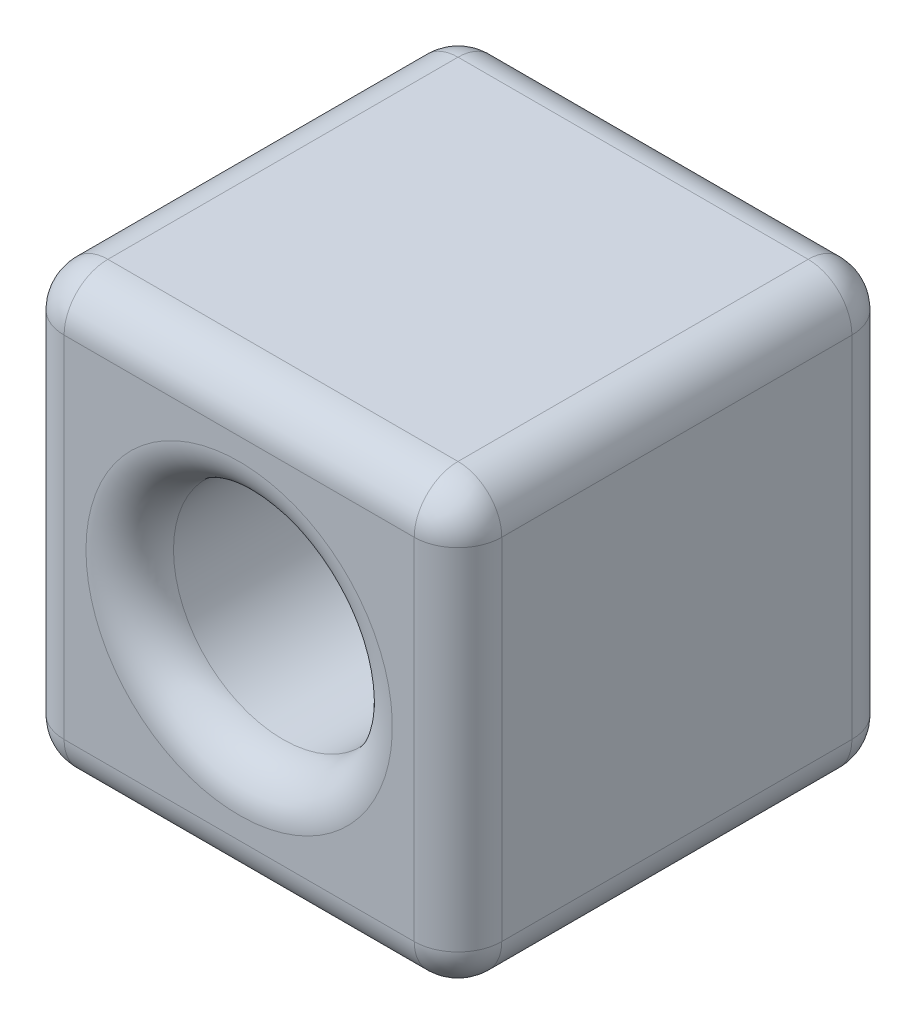
from build123d import *

# Parameters (mm, degrees)
SKETCH2_W           = 100
SKETCH2_H           = 100
BOSS_EXTRUDE1_DEPTH = 100
SKETCH3_R           = 25
CUT_EXTRUDE1_DEPTH  = 100
FILLET1_R           = 10
FILLET2_R           = 10
FILLET3_R           = 10
FILLET4_R           = 10


with BuildPart() as part:
    # Sketch2 → Boss-Extrude1 (new body)
    with BuildSketch(Plane(origin=(0, 0, 0), x_dir=(1, 0, 0), z_dir=(0, 1, 0))):
        with Locations((50, 50)):
            Rectangle(SKETCH2_W, SKETCH2_H)
    extrude(amount=BOSS_EXTRUDE1_DEPTH)

    # Sketch3 → Cut-Extrude1 (cut)
    with BuildSketch(Plane.XY):
        with Locations((50, 50)):
            Circle(SKETCH3_R)
    extrude(amount=-CUT_EXTRUDE1_DEPTH, mode=Mode.SUBTRACT)

    # Fillet1
    fillet1_edges = [part.edges().sort_by_distance(p)[0] for p in [
        (25, 50, 0),
        (50, 0, 0),
        (100, 50, 0),
        (0, 50, 0),
        (50, 100, 0),
    ]]
    fillet(fillet1_edges, radius=FILLET1_R)

    # Fillet2
    fillet2_edges = [part.edges().sort_by_distance(p)[0] for p in [
        (25, 50, -100),
        (50, 100, -100),
        (50, 0, -100),
        (0, 50, -100),
        (100, 50, -100),
    ]]
    fillet(fillet2_edges, radius=FILLET2_R)

    # Fillet3
    # the kernel refuses this fillet: 10 mm, written as the material it takes off along each edge
    with BuildSketch(Plane(origin=(90, 90, -10), x_dir=(1, 0, 0), z_dir=(0, 1, 0))) as fillet3_piece_1_section:
        Polygon((0, 0), (FILLET3_R, 0), (FILLET3_R, -FILLET3_R), (0, -FILLET3_R), align=None)
    fillet3_piece_1 = extrude(amount=FILLET3_R, mode=Mode.PRIVATE)
    fillet3_piece_1 = fillet3_piece_1 - Plane(origin=(90, 90, -10), x_dir=(-0.7071067811865475, 0, -0.7071067811865475), z_dir=(0, 1, 0)) * Sphere(FILLET3_R, mode=Mode.PRIVATE)
    add(fillet3_piece_1, mode=Mode.SUBTRACT)
    with BuildSketch(Plane(origin=(90, 10, -10), x_dir=(0, -1, 0), z_dir=(1, 0, 0))) as fillet3_piece_2_section:
        Polygon((0, 0), (FILLET3_R, 0), (FILLET3_R, -FILLET3_R), (0, -FILLET3_R), align=None)
    fillet3_piece_2 = extrude(amount=FILLET3_R, mode=Mode.PRIVATE)
    fillet3_piece_2 = fillet3_piece_2 - Plane(origin=(90, 10, -10), x_dir=(0, 0.7071067811865475, -0.7071067811865475), z_dir=(1, 0, 0)) * Sphere(FILLET3_R, mode=Mode.PRIVATE)
    add(fillet3_piece_2, mode=Mode.SUBTRACT)
    with BuildSketch(Plane(origin=(90, 90, -90), x_dir=(1, 0, 0), z_dir=(0, 1, 0))) as fillet3_piece_3_section:
        Polygon((0, 0), (FILLET3_R, 0), (FILLET3_R, FILLET3_R), (0, FILLET3_R), align=None)
    fillet3_piece_3 = extrude(amount=FILLET3_R, mode=Mode.PRIVATE)
    fillet3_piece_3 = fillet3_piece_3 - Plane(origin=(90, 90, -90), x_dir=(-0.7071067811865475, 0, 0.7071067811865475), z_dir=(0, 1, 0)) * Sphere(FILLET3_R, mode=Mode.PRIVATE)
    add(fillet3_piece_3, mode=Mode.SUBTRACT)
    with BuildSketch(Plane(origin=(90, 10, -90), x_dir=(0, -1, 0), z_dir=(1, 0, 0))) as fillet3_piece_4_section:
        Polygon((0, 0), (FILLET3_R, 0), (FILLET3_R, FILLET3_R), (0, FILLET3_R), align=None)
    fillet3_piece_4 = extrude(amount=FILLET3_R, mode=Mode.PRIVATE)
    fillet3_piece_4 = fillet3_piece_4 - Plane(origin=(90, 10, -90), x_dir=(0, 0.7071067811865475, 0.7071067811865475), z_dir=(1, 0, 0)) * Sphere(FILLET3_R, mode=Mode.PRIVATE)
    add(fillet3_piece_4, mode=Mode.SUBTRACT)
    with BuildSketch(Plane(origin=(100, 100, -10), x_dir=(-1, 0, 0), z_dir=(0, 0, -1)), Plane(origin=(100, 0, -10), x_dir=(0, 1, 0), z_dir=(0, 0, -1))) as fillet3_piece_5:
        with BuildLine():
            CenterArc((FILLET3_R, -FILLET3_R), FILLET3_R, 90, 90)
            Line((0, -FILLET3_R), (0, 0))
            Line((0, 0), (FILLET3_R, 0))
        make_face()
    extrude(amount=80, mode=Mode.SUBTRACT)

    # Fillet4
    # the kernel refuses this fillet: 10 mm, written as the material it takes off along each edge
    with BuildSketch(Plane(origin=(10, 90, -10), x_dir=(-1, 0, 0), z_dir=(0, 1, 0))) as fillet4_piece_1_section:
        Polygon((0, 0), (FILLET4_R, 0), (FILLET4_R, FILLET4_R), (0, FILLET4_R), align=None)
    fillet4_piece_1 = extrude(amount=FILLET4_R, mode=Mode.PRIVATE)
    fillet4_piece_1 = fillet4_piece_1 - Plane(origin=(10, 90, -10), x_dir=(0.7071067811865475, 0, -0.7071067811865475), z_dir=(0, 1, 0)) * Sphere(FILLET4_R, mode=Mode.PRIVATE)
    add(fillet4_piece_1, mode=Mode.SUBTRACT)
    with BuildSketch(Plane(origin=(10, 10, -10), x_dir=(0, -1, 0), z_dir=(-1, 0, 0))) as fillet4_piece_2_section:
        Polygon((0, 0), (FILLET4_R, 0), (FILLET4_R, FILLET4_R), (0, FILLET4_R), align=None)
    fillet4_piece_2 = extrude(amount=FILLET4_R, mode=Mode.PRIVATE)
    fillet4_piece_2 = fillet4_piece_2 - Plane(origin=(10, 10, -10), x_dir=(0, 0.7071067811865475, -0.7071067811865475), z_dir=(-1, 0, 0)) * Sphere(FILLET4_R, mode=Mode.PRIVATE)
    add(fillet4_piece_2, mode=Mode.SUBTRACT)
    with BuildSketch(Plane(origin=(10, 90, -90), x_dir=(-1, 0, 0), z_dir=(0, 1, 0))) as fillet4_piece_3_section:
        Polygon((0, 0), (FILLET4_R, 0), (FILLET4_R, -FILLET4_R), (0, -FILLET4_R), align=None)
    fillet4_piece_3 = extrude(amount=FILLET4_R, mode=Mode.PRIVATE)
    fillet4_piece_3 = fillet4_piece_3 - Plane(origin=(10, 90, -90), x_dir=(0.7071067811865475, 0, 0.7071067811865475), z_dir=(0, 1, 0)) * Sphere(FILLET4_R, mode=Mode.PRIVATE)
    add(fillet4_piece_3, mode=Mode.SUBTRACT)
    with BuildSketch(Plane(origin=(10, 10, -90), x_dir=(0, -1, 0), z_dir=(-1, 0, 0))) as fillet4_piece_4_section:
        Polygon((0, 0), (FILLET4_R, 0), (FILLET4_R, -FILLET4_R), (0, -FILLET4_R), align=None)
    fillet4_piece_4 = extrude(amount=FILLET4_R, mode=Mode.PRIVATE)
    fillet4_piece_4 = fillet4_piece_4 - Plane(origin=(10, 10, -90), x_dir=(0, 0.7071067811865475, 0.7071067811865475), z_dir=(-1, 0, 0)) * Sphere(FILLET4_R, mode=Mode.PRIVATE)
    add(fillet4_piece_4, mode=Mode.SUBTRACT)
    with BuildSketch(Plane(origin=(0, 100, -90), x_dir=(1, 0, 0), z_dir=(0, 0, 1)), Plane(origin=(0, 0, -90), x_dir=(0, 1, 0), z_dir=(0, 0, 1))) as fillet4_piece_5:
        with BuildLine():
            CenterArc((FILLET4_R, -FILLET4_R), FILLET4_R, 90, 90)
            Line((0, -FILLET4_R), (0, 0))
            Line((0, 0), (FILLET4_R, 0))
        make_face()
    extrude(amount=80, mode=Mode.SUBTRACT)


solid = part.part
